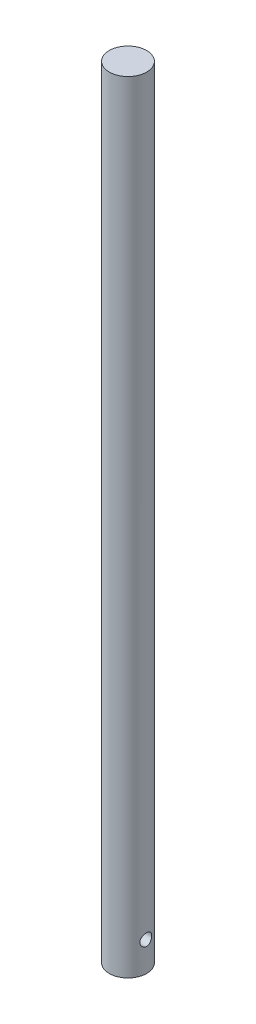
from build123d import *

# Parameters (mm, degrees)
SKETCH1_R                           = 12.7
EXTRUDE1_DEPTH                      = 530
CUT_EXTRUDE1_REACH                  = 532.304
CUT_EXTRUDE1_END_RADIUS             = 12.7
SKETCH2_R                           = 4
CUT_EXTRUDE1_DIRECTION_2_REACH      = 532.304
CUT_EXTRUDE1_DIRECTION_2_END_RADIUS = 12.7


with BuildPart() as part:
    # Sketch1 → Extrude1 (new body)
    with BuildSketch(Plane(origin=(0, 0, 0), x_dir=(1, 0, 0), z_dir=(0, 1, 0))):
        Circle(SKETCH1_R)
    extrude(amount=EXTRUDE1_DEPTH)

    # Cut-Extrude1: up to this cylinder (the profile starts inside it)
    cut_extrude1_end = Plane(origin=(0, 20, 0), z_dir=(0, -1, 0)) * Cylinder(CUT_EXTRUDE1_END_RADIUS, 1091.008, mode=Mode.PRIVATE)
    # Sketch2 → Cut-Extrude1 (cut, up to the surface)
    with BuildSketch(Plane(origin=(0, 0, 0), x_dir=(0, 0, -1), z_dir=(1, 0, 0)), mode=Mode.PRIVATE) as cut_extrude1_sk1:
        with Locations((0, 20)):
            Circle(SKETCH2_R)
    cut_extrude1_tool1 = extrude(cut_extrude1_sk1.sketch, amount=-CUT_EXTRUDE1_REACH, mode=Mode.PRIVATE) & cut_extrude1_end
    add(cut_extrude1_tool1.solids().sort_by_distance((0, 20, 0))[0], mode=Mode.SUBTRACT)

    # Cut-Extrude1 direction 2: up to this cylinder (the profile starts inside it)
    cut_extrude1_direction_2_end = Plane(origin=(0, 20, 0), z_dir=(0, -1, 0)) * Cylinder(CUT_EXTRUDE1_DIRECTION_2_END_RADIUS, 1091.008, mode=Mode.PRIVATE)
    # Sketch2 → Cut-Extrude1 direction 2 (cut, up to the surface)
    with BuildSketch(Plane(origin=(0, 0, 0), x_dir=(0, 0, -1), z_dir=(1, 0, 0)), mode=Mode.PRIVATE) as cut_extrude1_direction_2_sk1:
        with Locations((0, 20)):
            Circle(SKETCH2_R)
    cut_extrude1_direction_2_tool1 = extrude(cut_extrude1_direction_2_sk1.sketch, amount=CUT_EXTRUDE1_DIRECTION_2_REACH, mode=Mode.PRIVATE) & cut_extrude1_direction_2_end
    add(cut_extrude1_direction_2_tool1.solids().sort_by_distance((0, 20, 0))[0], mode=Mode.SUBTRACT)


solid = part.part
